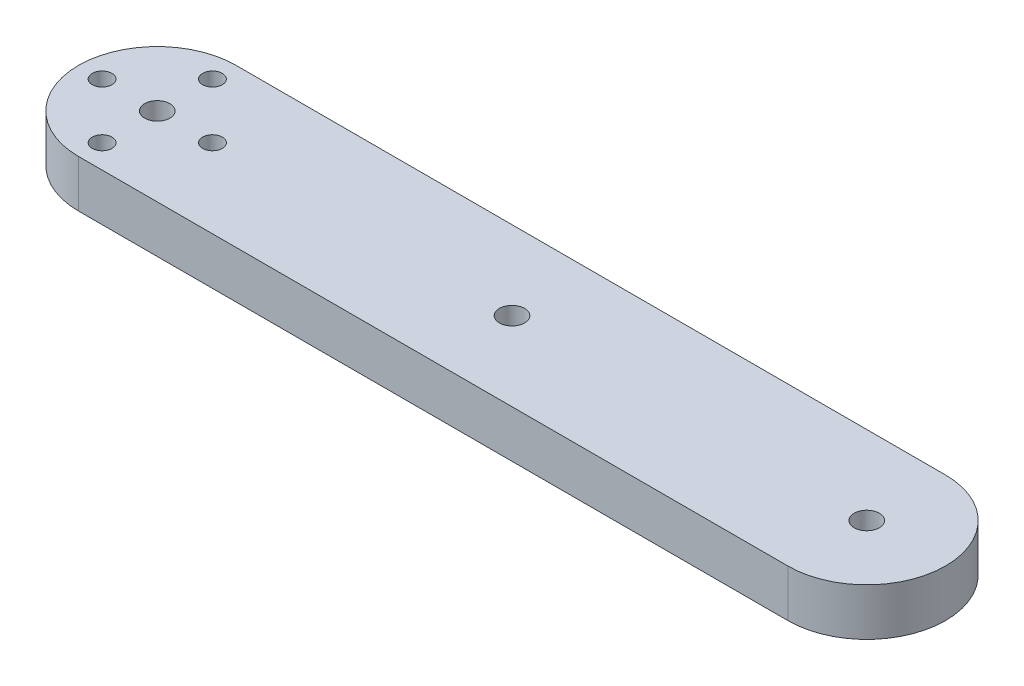
from build123d import *

# Parameters (mm, degrees)
SKETCH1_R           = 1.6
SKETCH1_R_2         = 1.25
BOSS_EXTRUDE1_DEPTH = 6


with BuildPart() as part:
    # Sketch1 → Boss-Extrude1 (new body)
    with BuildSketch(Plane(origin=(0, 0, 0), x_dir=(1, 0, 0), z_dir=(0, 1, 0))):
        with BuildLine():
            Line((0, 0), (-90, 0))
            ThreePointArc((-90, 0), (-100, 10), (-90, 20))
            Line((-90, 20), (0, 20))
            ThreePointArc((0, 20), (10, 10), (0, 0))
        make_face()
        with Locations((-90, 10)):
            Circle(SKETCH1_R, mode=Mode.SUBTRACT)
        with Locations((-90, 17)):
            Circle(SKETCH1_R_2, mode=Mode.SUBTRACT)
        with Locations((-90, 3)):
            Circle(SKETCH1_R_2, mode=Mode.SUBTRACT)
        with Locations((-97, 10)):
            Circle(SKETCH1_R_2, mode=Mode.SUBTRACT)
        with Locations((-83, 10)):
            Circle(SKETCH1_R_2, mode=Mode.SUBTRACT)
        with Locations((0, 10)):
            Circle(SKETCH1_R, mode=Mode.SUBTRACT)
        with Locations((-45, 10)):
            Circle(SKETCH1_R, mode=Mode.SUBTRACT)
    extrude(amount=BOSS_EXTRUDE1_DEPTH)


solid = part.part
